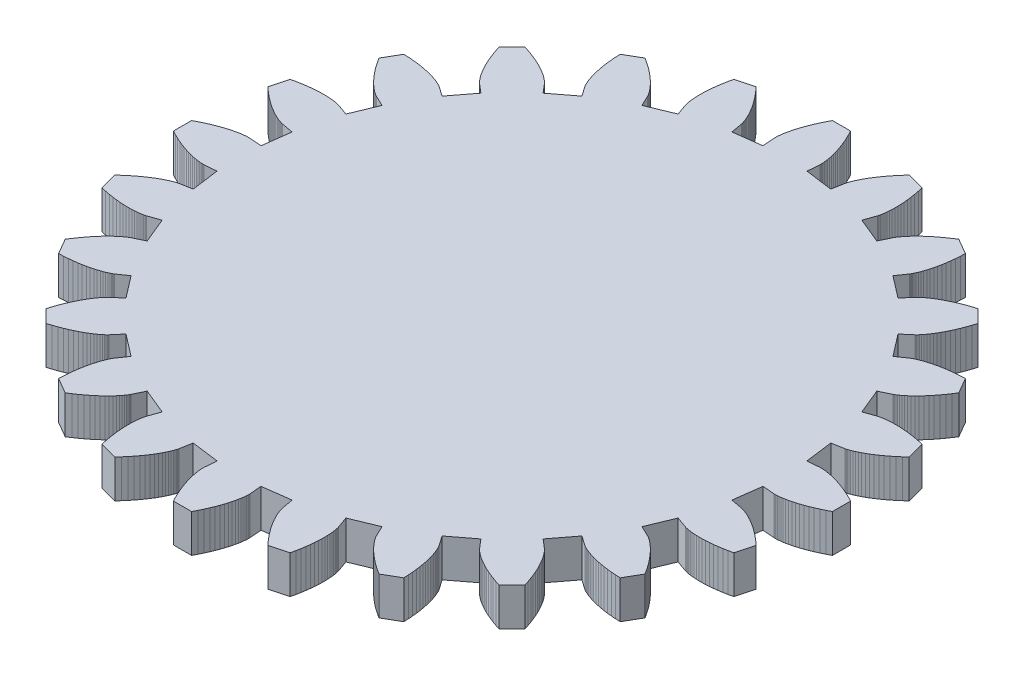
from build123d import *

# Parameters (mm, degrees)
BOSS_EXTRUDE1_DEPTH = 3


with BuildPart() as part:
    # Sketch1 → Boss-Extrude1 (new body)
    with BuildSketch(Plane(origin=(0, 0, 0), x_dir=(1, 0, 0), z_dir=(0, 1, 0))):
        Polygon((21.530304115, 1.73378335), (22.479853223, 1.810248244), (22.490113679, 1.810866937), (22.520933425, 1.81189633), (22.572327881, 1.812095046), (22.644256248, 1.810221715), (22.73662154, 1.80503724), (22.849270696, 1.795307058), (22.981994789, 1.779803389), (23.134529308, 1.75730749), (23.306554532, 1.726611885), (23.497695986, 1.686522588), (23.707524981, 1.6358613), (23.935559237, 1.573467598), (24.181263587, 1.498201084), (24.444050762, 1.408943525), (24.723282261, 1.304600946), (25.018269294, 1.184105704), (25.328273805, 1.046418516), (25.652509577, 0.890530461), (25.9901434, 0.715464925), (25.9901434, -0.715464925), (25.652509577, -0.890530461), (25.328273805, -1.046418516), (25.018269294, -1.184105704), (24.723282261, -1.304600946), (24.444050762, -1.408943525), (24.181263587, -1.498201084), (23.935559237, -1.573467598), (23.707524981, -1.6358613), (23.497695986, -1.686522588), (23.306554532, -1.726611885), (23.134529308, -1.75730749), (22.981994789, -1.779803389), (22.849270696, -1.795307058), (22.73662154, -1.80503724), (22.644256248, -1.810221715), (22.572327881, -1.812095046), (22.520933425, -1.81189633), (22.490113679, -1.810866937), (22.479853223, -1.810248244), (21.530304115, -1.73378335), (21.245412944, -3.897746637), (22.182397521, -4.069648614), (22.19246849, -4.071706604), (22.222504505, -4.078689024), (22.272199169, -4.091798944), (22.341191783, -4.112224874), (22.429067963, -4.141138588), (22.535360336, -4.17969297), (22.65954932, -4.229019887), (22.801063984, -4.290228095), (22.959282983, -4.364401176), (23.133535576, -4.452595513), (23.323102716, -4.555838299), (23.527218215, -4.675125596), (23.745069985, -4.81142043), (23.975801348, -4.965650938), (24.218512418, -5.138708559), (24.472261547, -5.331446288), (24.736066845, -5.54467697), (25.008907753, -5.779171662), (25.289726687, -6.035658048), (24.91937479, -7.417830146), (24.547935266, -7.499544404), (24.194400763, -7.56620231), (23.859323332, -7.618962849), (23.543201275, -7.659004054), (23.246478512, -7.687520816), (22.969544036, -7.705722671), (22.712731453, -7.714831575), (22.476318597, -7.716079655), (22.260527245, -7.710706961), (22.065522904, -7.6999592), (21.891414691, -7.685085474), (21.738255293, -7.667336005), (21.606041019, -7.647959876), (21.494711933, -7.628202764), (21.404152072, -7.609304685), (21.33418975, -7.592497752), (21.284597949, -7.579003944), (21.255094788, -7.570032889), (21.245344077, -7.566779676), (20.347940642, -7.247158867), (19.51268199, -9.263651632), (20.373248086, -9.672205644), (20.382443249, -9.676800069), (20.409648628, -9.691318462), (20.45425689, -9.716843597), (20.515612018, -9.754430133), (20.59301047, -9.805102665), (20.68570241, -9.869853829), (20.792893011, -9.949642446), (20.91374383, -10.045391725), (21.047374242, -10.157987511), (21.192862948, -10.288276588), (21.349249544, -10.437065047), (21.515536152, -10.605116707), (21.690689104, -10.793151594), (21.873640694, -11.001844495), (22.063290976, -11.231823569), (22.258509619, -11.483669027), (22.458137808, -11.757911885), (22.660990195, -12.055032786), (22.865856895, -12.375460899), (22.150391969, -13.614682501), (21.770459734, -13.59747679), (21.411719291, -13.570361921), (21.074403915, -13.534600267), (20.75869003, -13.491458692), (20.464697168, -13.442206266), (20.192488019, -13.388111992), (19.942068554, -13.33044253), (19.713388244, -13.270459933), (19.50634036, -13.209419398), (19.320762356, -13.148567021), (19.15643634, -13.089137582), (19.013089623, -13.032352343), (18.890395352, -12.979416868), (18.787973229, -12.931518875), (18.705390303, -12.889826116), (18.642161844, -12.855484284), (18.597752298, -12.829614963), (18.571576312, -12.81331361), (18.562999842, -12.807647578), (17.77889864, -12.266652483), (16.450194005, -13.998254077), (17.175695463, -14.615617844), (17.183388183, -14.622435601), (17.205908925, -14.643500562), (17.242390806, -14.679701417), (17.291927198, -14.731887098), (17.353573345, -14.800865199), (17.426348049, -14.88740046), (17.509235406, -14.992213315), (17.601186596, -15.11597851), (17.701121728, -15.259323783), (17.807931732, -15.422828615), (17.920480298, -15.607023061), (18.037605856, -15.81238664), (18.158123606, -16.039347313), (18.280827574, -16.288280532), (18.404492716, -16.559508364), (18.527877044, -16.853298698), (18.649723792, -17.169864535), (18.768763604, -17.509363348), (18.883716742, -17.871896541), (17.871896541, -18.883716742), (17.509363348, -18.768763604), (17.169864535, -18.649723792), (16.853298698, -18.527877044), (16.559508364, -18.404492716), (16.288280532, -18.280827574), (16.039347313, -18.158123606), (15.81238664, -18.037605856), (15.607023061, -17.920480298), (15.422828615, -17.807931732), (15.259323783, -17.701121728), (15.11597851, -17.601186596), (14.992213315, -17.509235406), (14.88740046, -17.426348049), (14.800865199, -17.353573345), (14.731887098, -17.291927198), (14.679701417, -17.242390806), (14.643500562, -17.205908925), (14.622435601, -17.183388183), (14.615617844, -17.175695463), (13.998254077, -16.450194005), (12.266652483, -17.77889864), (12.807647578, -18.562999842), (12.81331361, -18.571576312), (12.829614963, -18.597752298), (12.855484284, -18.642161844), (12.889826116, -18.705390303), (12.931518875, -18.787973229), (12.979416868, -18.890395352), (13.032352343, -19.013089623), (13.089137582, -19.15643634), (13.148567021, -19.320762356), (13.209419398, -19.50634036), (13.270459933, -19.713388244), (13.33044253, -19.942068554), (13.388111992, -20.192488019), (13.442206266, -20.464697168), (13.491458692, -20.75869003), (13.534600267, -21.074403915), (13.570361921, -21.411719291), (13.59747679, -21.770459734), (13.614682501, -22.150391969), (12.375460899, -22.865856895), (12.055032786, -22.660990195), (11.757911885, -22.458137808), (11.483669027, -22.258509619), (11.231823569, -22.063290976), (11.001844495, -21.873640694), (10.793151594, -21.690689104), (10.605116707, -21.515536152), (10.437065047, -21.349249544), (10.288276588, -21.192862948), (10.157987511, -21.047374242), (10.045391725, -20.91374383), (9.949642446, -20.792893011), (9.869853829, -20.68570241), (9.805102665, -20.59301047), (9.754430133, -20.515612018), (9.716843597, -20.45425689), (9.691318462, -20.409648628), (9.676800069, -20.382443249), (9.672205644, -20.373248086), (9.263651632, -19.51268199), (7.247158867, -20.347940642), (7.566779676, -21.245344077), (7.570032889, -21.255094788), (7.579003944, -21.284597949), (7.592497752, -21.33418975), (7.609304685, -21.404152072), (7.628202764, -21.494711933), (7.647959876, -21.606041019), (7.667336005, -21.738255293), (7.685085474, -21.891414691), (7.6999592, -22.065522904), (7.710706961, -22.260527245), (7.716079655, -22.476318597), (7.714831575, -22.712731453), (7.705722671, -22.969544036), (7.687520816, -23.246478512), (7.659004054, -23.543201275), (7.618962849, -23.859323332), (7.56620231, -24.194400763), (7.499544404, -24.547935266), (7.417830146, -24.91937479), (6.035658048, -25.289726687), (5.779171662, -25.008907753), (5.54467697, -24.736066845), (5.331446288, -24.472261547), (5.138708559, -24.218512418), (4.965650938, -23.975801348), (4.81142043, -23.745069985), (4.675125596, -23.527218215), (4.555838299, -23.323102716), (4.452595513, -23.133535576), (4.364401176, -22.959282983), (4.290228095, -22.801063984), (4.229019887, -22.65954932), (4.17969297, -22.535360336), (4.141138588, -22.429067963), (4.112224874, -22.341191783), (4.091798944, -22.272199169), (4.078689024, -22.222504505), (4.071706604, -22.19246849), (4.069648614, -22.182397521), (3.897746637, -21.245412944), (1.73378335, -21.530304115), (1.810248244, -22.479853223), (1.810866937, -22.490113679), (1.81189633, -22.520933425), (1.812095046, -22.572327881), (1.810221715, -22.644256248), (1.80503724, -22.73662154), (1.795307058, -22.849270696), (1.779803389, -22.981994789), (1.75730749, -23.134529308), (1.726611885, -23.306554532), (1.686522588, -23.497695986), (1.6358613, -23.707524981), (1.573467598, -23.935559237), (1.498201084, -24.181263587), (1.408943525, -24.444050762), (1.304600946, -24.723282261), (1.184105704, -25.018269294), (1.046418516, -25.328273805), (0.890530461, -25.652509577), (0.715464925, -25.9901434), (-0.715464925, -25.9901434), (-0.890530461, -25.652509577), (-1.046418516, -25.328273805), (-1.184105704, -25.018269294), (-1.304600946, -24.723282261), (-1.408943525, -24.444050762), (-1.498201084, -24.181263587), (-1.573467598, -23.935559237), (-1.6358613, -23.707524981), (-1.686522588, -23.497695986), (-1.726611885, -23.306554532), (-1.75730749, -23.134529308), (-1.779803389, -22.981994789), (-1.795307058, -22.849270696), (-1.80503724, -22.73662154), (-1.810221715, -22.644256248), (-1.812095046, -22.572327881), (-1.81189633, -22.520933425), (-1.810866937, -22.490113679), (-1.810248244, -22.479853223), (-1.73378335, -21.530304115), (-3.897746637, -21.245412944), (-4.069648614, -22.182397521), (-4.071706604, -22.19246849), (-4.078689024, -22.222504505), (-4.091798944, -22.272199169), (-4.112224874, -22.341191783), (-4.141138588, -22.429067963), (-4.17969297, -22.535360336), (-4.229019887, -22.65954932), (-4.290228095, -22.801063984), (-4.364401176, -22.959282983), (-4.452595513, -23.133535576), (-4.555838299, -23.323102716), (-4.675125596, -23.527218215), (-4.81142043, -23.745069985), (-4.965650938, -23.975801348), (-5.138708559, -24.218512418), (-5.331446288, -24.472261547), (-5.54467697, -24.736066845), (-5.779171662, -25.008907753), (-6.035658048, -25.289726687), (-7.417830146, -24.91937479), (-7.499544404, -24.547935266), (-7.56620231, -24.194400763), (-7.618962849, -23.859323332), (-7.659004054, -23.543201275), (-7.687520816, -23.246478512), (-7.705722671, -22.969544036), (-7.714831575, -22.712731453), (-7.716079655, -22.476318597), (-7.710706961, -22.260527245), (-7.6999592, -22.065522904), (-7.685085474, -21.891414691), (-7.667336005, -21.738255293), (-7.647959876, -21.606041019), (-7.628202764, -21.494711933), (-7.609304685, -21.404152072), (-7.592497752, -21.33418975), (-7.579003944, -21.284597949), (-7.570032889, -21.255094788), (-7.566779676, -21.245344077), (-7.247158867, -20.347940642), (-9.263651632, -19.51268199), (-9.672205644, -20.373248086), (-9.676800069, -20.382443249), (-9.691318462, -20.409648628), (-9.716843597, -20.45425689), (-9.754430133, -20.515612018), (-9.805102665, -20.59301047), (-9.869853829, -20.68570241), (-9.949642446, -20.792893011), (-10.045391725, -20.91374383), (-10.157987511, -21.047374242), (-10.288276588, -21.192862948), (-10.437065047, -21.349249544), (-10.605116707, -21.515536152), (-10.793151594, -21.690689104), (-11.001844495, -21.873640694), (-11.231823569, -22.063290976), (-11.483669027, -22.258509619), (-11.757911885, -22.458137808), (-12.055032786, -22.660990195), (-12.375460899, -22.865856895), (-13.614682501, -22.150391969), (-13.59747679, -21.770459734), (-13.570361921, -21.411719291), (-13.534600267, -21.074403915), (-13.491458692, -20.75869003), (-13.442206266, -20.464697168), (-13.388111992, -20.192488019), (-13.33044253, -19.942068554), (-13.270459933, -19.713388244), (-13.209419398, -19.50634036), (-13.148567021, -19.320762356), (-13.089137582, -19.15643634), (-13.032352343, -19.013089623), (-12.979416868, -18.890395352), (-12.931518875, -18.787973229), (-12.889826116, -18.705390303), (-12.855484284, -18.642161844), (-12.829614963, -18.597752298), (-12.81331361, -18.571576312), (-12.807647578, -18.562999842), (-12.266652483, -17.77889864), (-13.998254077, -16.450194005), (-14.615617844, -17.175695463), (-14.622435601, -17.183388183), (-14.643500562, -17.205908925), (-14.679701417, -17.242390806), (-14.731887098, -17.291927198), (-14.800865199, -17.353573345), (-14.88740046, -17.426348049), (-14.992213315, -17.509235406), (-15.11597851, -17.601186596), (-15.259323783, -17.701121728), (-15.422828615, -17.807931732), (-15.607023061, -17.920480298), (-15.81238664, -18.037605856), (-16.039347313, -18.158123606), (-16.288280532, -18.280827574), (-16.559508364, -18.404492716), (-16.853298698, -18.527877044), (-17.169864535, -18.649723792), (-17.509363348, -18.768763604), (-17.871896541, -18.883716742), (-18.883716742, -17.871896541), (-18.768763604, -17.509363348), (-18.649723792, -17.169864535), (-18.527877044, -16.853298698), (-18.404492716, -16.559508364), (-18.280827574, -16.288280532), (-18.158123606, -16.039347313), (-18.037605856, -15.81238664), (-17.920480298, -15.607023061), (-17.807931732, -15.422828615), (-17.701121728, -15.259323783), (-17.601186596, -15.11597851), (-17.509235406, -14.992213315), (-17.426348049, -14.88740046), (-17.353573345, -14.800865199), (-17.291927198, -14.731887098), (-17.242390806, -14.679701417), (-17.205908925, -14.643500562), (-17.183388183, -14.622435601), (-17.175695463, -14.615617844), (-16.450194005, -13.998254077), (-17.77889864, -12.266652483), (-18.562999842, -12.807647578), (-18.571576312, -12.81331361), (-18.597752298, -12.829614963), (-18.642161844, -12.855484284), (-18.705390303, -12.889826116), (-18.787973229, -12.931518875), (-18.890395352, -12.979416868), (-19.013089623, -13.032352343), (-19.15643634, -13.089137582), (-19.320762356, -13.148567021), (-19.50634036, -13.209419398), (-19.713388244, -13.270459933), (-19.942068554, -13.33044253), (-20.192488019, -13.388111992), (-20.464697168, -13.442206266), (-20.75869003, -13.491458692), (-21.074403915, -13.534600267), (-21.411719291, -13.570361921), (-21.770459734, -13.59747679), (-22.150391969, -13.614682501), (-22.865856895, -12.375460899), (-22.660990195, -12.055032786), (-22.458137808, -11.757911885), (-22.258509619, -11.483669027), (-22.063290976, -11.231823569), (-21.873640694, -11.001844495), (-21.690689104, -10.793151594), (-21.515536152, -10.605116707), (-21.349249544, -10.437065047), (-21.192862948, -10.288276588), (-21.047374242, -10.157987511), (-20.91374383, -10.045391725), (-20.792893011, -9.949642446), (-20.68570241, -9.869853829), (-20.59301047, -9.805102665), (-20.515612018, -9.754430133), (-20.45425689, -9.716843597), (-20.409648628, -9.691318462), (-20.382443249, -9.676800069), (-20.373248086, -9.672205644), (-19.51268199, -9.263651632), (-20.347940642, -7.247158867), (-21.245344077, -7.566779676), (-21.255094788, -7.570032889), (-21.284597949, -7.579003944), (-21.33418975, -7.592497752), (-21.404152072, -7.609304685), (-21.494711933, -7.628202764), (-21.606041019, -7.647959876), (-21.738255293, -7.667336005), (-21.891414691, -7.685085474), (-22.065522904, -7.6999592), (-22.260527245, -7.710706961), (-22.476318597, -7.716079655), (-22.712731453, -7.714831575), (-22.969544036, -7.705722671), (-23.246478512, -7.687520816), (-23.543201275, -7.659004054), (-23.859323332, -7.618962849), (-24.194400763, -7.56620231), (-24.547935266, -7.499544404), (-24.91937479, -7.417830146), (-25.289726687, -6.035658048), (-25.008907753, -5.779171662), (-24.736066845, -5.54467697), (-24.472261547, -5.331446288), (-24.218512418, -5.138708559), (-23.975801348, -4.965650938), (-23.745069985, -4.81142043), (-23.527218215, -4.675125596), (-23.323102716, -4.555838299), (-23.133535576, -4.452595513), (-22.959282983, -4.364401176), (-22.801063984, -4.290228095), (-22.65954932, -4.229019887), (-22.535360336, -4.17969297), (-22.429067963, -4.141138588), (-22.341191783, -4.112224874), (-22.272199169, -4.091798944), (-22.222504505, -4.078689024), (-22.19246849, -4.071706604), (-22.182397521, -4.069648614), (-21.245412944, -3.897746637), (-21.530304115, -1.73378335), (-22.479853223, -1.810248244), (-22.490113679, -1.810866937), (-22.520933425, -1.81189633), (-22.572327881, -1.812095046), (-22.644256248, -1.810221715), (-22.73662154, -1.80503724), (-22.849270696, -1.795307058), (-22.981994789, -1.779803389), (-23.134529308, -1.75730749), (-23.306554532, -1.726611885), (-23.497695986, -1.686522588), (-23.707524981, -1.6358613), (-23.935559237, -1.573467598), (-24.181263587, -1.498201084), (-24.444050762, -1.408943525), (-24.723282261, -1.304600946), (-25.018269294, -1.184105704), (-25.328273805, -1.046418516), (-25.652509577, -0.890530461), (-25.9901434, -0.715464925), (-25.9901434, 0.715464925), (-25.652509577, 0.890530461), (-25.328273805, 1.046418516), (-25.018269294, 1.184105704), (-24.723282261, 1.304600946), (-24.444050762, 1.408943525), (-24.181263587, 1.498201084), (-23.935559237, 1.573467598), (-23.707524981, 1.6358613), (-23.497695986, 1.686522588), (-23.306554532, 1.726611885), (-23.134529308, 1.75730749), (-22.981994789, 1.779803389), (-22.849270696, 1.795307058), (-22.73662154, 1.80503724), (-22.644256248, 1.810221715), (-22.572327881, 1.812095046), (-22.520933425, 1.81189633), (-22.490113679, 1.810866937), (-22.479853223, 1.810248244), (-21.530304115, 1.73378335), (-21.245412944, 3.897746637), (-22.182397521, 4.069648614), (-22.19246849, 4.071706604), (-22.222504505, 4.078689024), (-22.272199169, 4.091798944), (-22.341191783, 4.112224874), (-22.429067963, 4.141138588), (-22.535360336, 4.17969297), (-22.65954932, 4.229019887), (-22.801063984, 4.290228095), (-22.959282983, 4.364401176), (-23.133535576, 4.452595513), (-23.323102716, 4.555838299), (-23.527218215, 4.675125596), (-23.745069985, 4.81142043), (-23.975801348, 4.965650938), (-24.218512418, 5.138708559), (-24.472261547, 5.331446288), (-24.736066845, 5.54467697), (-25.008907753, 5.779171662), (-25.289726687, 6.035658048), (-24.91937479, 7.417830146), (-24.547935266, 7.499544404), (-24.194400763, 7.56620231), (-23.859323332, 7.618962849), (-23.543201275, 7.659004054), (-23.246478512, 7.687520816), (-22.969544036, 7.705722671), (-22.712731453, 7.714831575), (-22.476318597, 7.716079655), (-22.260527245, 7.710706961), (-22.065522904, 7.6999592), (-21.891414691, 7.685085474), (-21.738255293, 7.667336005), (-21.606041019, 7.647959876), (-21.494711933, 7.628202764), (-21.404152072, 7.609304685), (-21.33418975, 7.592497752), (-21.284597949, 7.579003944), (-21.255094788, 7.570032889), (-21.245344077, 7.566779676), (-20.347940642, 7.247158867), (-19.51268199, 9.263651632), (-20.373248086, 9.672205644), (-20.382443249, 9.676800069), (-20.409648628, 9.691318462), (-20.45425689, 9.716843597), (-20.515612018, 9.754430133), (-20.59301047, 9.805102665), (-20.68570241, 9.869853829), (-20.792893011, 9.949642446), (-20.91374383, 10.045391725), (-21.047374242, 10.157987511), (-21.192862948, 10.288276588), (-21.349249544, 10.437065047), (-21.515536152, 10.605116707), (-21.690689104, 10.793151594), (-21.873640694, 11.001844495), (-22.063290976, 11.231823569), (-22.258509619, 11.483669027), (-22.458137808, 11.757911885), (-22.660990195, 12.055032786), (-22.865856895, 12.375460899), (-22.150391969, 13.614682501), (-21.770459734, 13.59747679), (-21.411719291, 13.570361921), (-21.074403915, 13.534600267), (-20.75869003, 13.491458692), (-20.464697168, 13.442206266), (-20.192488019, 13.388111992), (-19.942068554, 13.33044253), (-19.713388244, 13.270459933), (-19.50634036, 13.209419398), (-19.320762356, 13.148567021), (-19.15643634, 13.089137582), (-19.013089623, 13.032352343), (-18.890395352, 12.979416868), (-18.787973229, 12.931518875), (-18.705390303, 12.889826116), (-18.642161844, 12.855484284), (-18.597752298, 12.829614963), (-18.571576312, 12.81331361), (-18.562999842, 12.807647578), (-17.77889864, 12.266652483), (-16.450194005, 13.998254077), (-17.175695463, 14.615617844), (-17.183388183, 14.622435601), (-17.205908925, 14.643500562), (-17.242390806, 14.679701417), (-17.291927198, 14.731887098), (-17.353573345, 14.800865199), (-17.426348049, 14.88740046), (-17.509235406, 14.992213315), (-17.601186596, 15.11597851), (-17.701121728, 15.259323783), (-17.807931732, 15.422828615), (-17.920480298, 15.607023061), (-18.037605856, 15.81238664), (-18.158123606, 16.039347313), (-18.280827574, 16.288280532), (-18.404492716, 16.559508364), (-18.527877044, 16.853298698), (-18.649723792, 17.169864535), (-18.768763604, 17.509363348), (-18.883716742, 17.871896541), (-17.871896541, 18.883716742), (-17.509363348, 18.768763604), (-17.169864535, 18.649723792), (-16.853298698, 18.527877044), (-16.559508364, 18.404492716), (-16.288280532, 18.280827574), (-16.039347313, 18.158123606), (-15.81238664, 18.037605856), (-15.607023061, 17.920480298), (-15.422828615, 17.807931732), (-15.259323783, 17.701121728), (-15.11597851, 17.601186596), (-14.992213315, 17.509235406), (-14.88740046, 17.426348049), (-14.800865199, 17.353573345), (-14.731887098, 17.291927198), (-14.679701417, 17.242390806), (-14.643500562, 17.205908925), (-14.622435601, 17.183388183), (-14.615617844, 17.175695463), (-13.998254077, 16.450194005), (-12.266652483, 17.77889864), (-12.807647578, 18.562999842), (-12.81331361, 18.571576312), (-12.829614963, 18.597752298), (-12.855484284, 18.642161844), (-12.889826116, 18.705390303), (-12.931518875, 18.787973229), (-12.979416868, 18.890395352), (-13.032352343, 19.013089623), (-13.089137582, 19.15643634), (-13.148567021, 19.320762356), (-13.209419398, 19.50634036), (-13.270459933, 19.713388244), (-13.33044253, 19.942068554), (-13.388111992, 20.192488019), (-13.442206266, 20.464697168), (-13.491458692, 20.75869003), (-13.534600267, 21.074403915), (-13.570361921, 21.411719291), (-13.59747679, 21.770459734), (-13.614682501, 22.150391969), (-12.375460899, 22.865856895), (-12.055032786, 22.660990195), (-11.757911885, 22.458137808), (-11.483669027, 22.258509619), (-11.231823569, 22.063290976), (-11.001844495, 21.873640694), (-10.793151594, 21.690689104), (-10.605116707, 21.515536152), (-10.437065047, 21.349249544), (-10.288276588, 21.192862948), (-10.157987511, 21.047374242), (-10.045391725, 20.91374383), (-9.949642446, 20.792893011), (-9.869853829, 20.68570241), (-9.805102665, 20.59301047), (-9.754430133, 20.515612018), (-9.716843597, 20.45425689), (-9.691318462, 20.409648628), (-9.676800069, 20.382443249), (-9.672205644, 20.373248086), (-9.263651632, 19.51268199), (-7.247158867, 20.347940642), (-7.566779676, 21.245344077), (-7.570032889, 21.255094788), (-7.579003944, 21.284597949), (-7.592497752, 21.33418975), (-7.609304685, 21.404152072), (-7.628202764, 21.494711933), (-7.647959876, 21.606041019), (-7.667336005, 21.738255293), (-7.685085474, 21.891414691), (-7.6999592, 22.065522904), (-7.710706961, 22.260527245), (-7.716079655, 22.476318597), (-7.714831575, 22.712731453), (-7.705722671, 22.969544036), (-7.687520816, 23.246478512), (-7.659004054, 23.543201275), (-7.618962849, 23.859323332), (-7.56620231, 24.194400763), (-7.499544404, 24.547935266), (-7.417830146, 24.91937479), (-6.035658048, 25.289726687), (-5.779171662, 25.008907753), (-5.54467697, 24.736066845), (-5.331446288, 24.472261547), (-5.138708559, 24.218512418), (-4.965650938, 23.975801348), (-4.81142043, 23.745069985), (-4.675125596, 23.527218215), (-4.555838299, 23.323102716), (-4.452595513, 23.133535576), (-4.364401176, 22.959282983), (-4.290228095, 22.801063984), (-4.229019887, 22.65954932), (-4.17969297, 22.535360336), (-4.141138588, 22.429067963), (-4.112224874, 22.341191783), (-4.091798944, 22.272199169), (-4.078689024, 22.222504505), (-4.071706604, 22.19246849), (-4.069648614, 22.182397521), (-3.897746637, 21.245412944), (-1.73378335, 21.530304115), (-1.810248244, 22.479853223), (-1.810866937, 22.490113679), (-1.81189633, 22.520933425), (-1.812095046, 22.572327881), (-1.810221715, 22.644256248), (-1.80503724, 22.73662154), (-1.795307058, 22.849270696), (-1.779803389, 22.981994789), (-1.75730749, 23.134529308), (-1.726611885, 23.306554532), (-1.686522588, 23.497695986), (-1.6358613, 23.707524981), (-1.573467598, 23.935559237), (-1.498201084, 24.181263587), (-1.408943525, 24.444050762), (-1.304600946, 24.723282261), (-1.184105704, 25.018269294), (-1.046418516, 25.328273805), (-0.890530461, 25.652509577), (-0.715464925, 25.9901434), (0.715464925, 25.9901434), (0.890530461, 25.652509577), (1.046418516, 25.328273805), (1.184105704, 25.018269294), (1.304600946, 24.723282261), (1.408943525, 24.444050762), (1.498201084, 24.181263587), (1.573467598, 23.935559237), (1.6358613, 23.707524981), (1.686522588, 23.497695986), (1.726611885, 23.306554532), (1.75730749, 23.134529308), (1.779803389, 22.981994789), (1.795307058, 22.849270696), (1.80503724, 22.73662154), (1.810221715, 22.644256248), (1.812095046, 22.572327881), (1.81189633, 22.520933425), (1.810866937, 22.490113679), (1.810248244, 22.479853223), (1.73378335, 21.530304115), (3.897746637, 21.245412944), (4.069648614, 22.182397521), (4.071706604, 22.19246849), (4.078689024, 22.222504505), (4.091798944, 22.272199169), (4.112224874, 22.341191783), (4.141138588, 22.429067963), (4.17969297, 22.535360336), (4.229019887, 22.65954932), (4.290228095, 22.801063984), (4.364401176, 22.959282983), (4.452595513, 23.133535576), (4.555838299, 23.323102716), (4.675125596, 23.527218215), (4.81142043, 23.745069985), (4.965650938, 23.975801348), (5.138708559, 24.218512418), (5.331446288, 24.472261547), (5.54467697, 24.736066845), (5.779171662, 25.008907753), (6.035658048, 25.289726687), (7.417830146, 24.91937479), (7.499544404, 24.547935266), (7.56620231, 24.194400763), (7.618962849, 23.859323332), (7.659004054, 23.543201275), (7.687520816, 23.246478512), (7.705722671, 22.969544036), (7.714831575, 22.712731453), (7.716079655, 22.476318597), (7.710706961, 22.260527245), (7.6999592, 22.065522904), (7.685085474, 21.891414691), (7.667336005, 21.738255293), (7.647959876, 21.606041019), (7.628202764, 21.494711933), (7.609304685, 21.404152072), (7.592497752, 21.33418975), (7.579003944, 21.284597949), (7.570032889, 21.255094788), (7.566779676, 21.245344077), (7.247158867, 20.347940642), (9.263651632, 19.51268199), (9.672205644, 20.373248086), (9.676800069, 20.382443249), (9.691318462, 20.409648628), (9.716843597, 20.45425689), (9.754430133, 20.515612018), (9.805102665, 20.59301047), (9.869853829, 20.68570241), (9.949642446, 20.792893011), (10.045391725, 20.91374383), (10.157987511, 21.047374242), (10.288276588, 21.192862948), (10.437065047, 21.349249544), (10.605116707, 21.515536152), (10.793151594, 21.690689104), (11.001844495, 21.873640694), (11.231823569, 22.063290976), (11.483669027, 22.258509619), (11.757911885, 22.458137808), (12.055032786, 22.660990195), (12.375460899, 22.865856895), (13.614682501, 22.150391969), (13.59747679, 21.770459734), (13.570361921, 21.411719291), (13.534600267, 21.074403915), (13.491458692, 20.75869003), (13.442206266, 20.464697168), (13.388111992, 20.192488019), (13.33044253, 19.942068554), (13.270459933, 19.713388244), (13.209419398, 19.50634036), (13.148567021, 19.320762356), (13.089137582, 19.15643634), (13.032352343, 19.013089623), (12.979416868, 18.890395352), (12.931518875, 18.787973229), (12.889826116, 18.705390303), (12.855484284, 18.642161844), (12.829614963, 18.597752298), (12.81331361, 18.571576312), (12.807647578, 18.562999842), (12.266652483, 17.77889864), (13.998254077, 16.450194005), (14.615617844, 17.175695463), (14.622435601, 17.183388183), (14.643500562, 17.205908925), (14.679701417, 17.242390806), (14.731887098, 17.291927198), (14.800865199, 17.353573345), (14.88740046, 17.426348049), (14.992213315, 17.509235406), (15.11597851, 17.601186596), (15.259323783, 17.701121728), (15.422828615, 17.807931732), (15.607023061, 17.920480298), (15.81238664, 18.037605856), (16.039347313, 18.158123606), (16.288280532, 18.280827574), (16.559508364, 18.404492716), (16.853298698, 18.527877044), (17.169864535, 18.649723792), (17.509363348, 18.768763604), (17.871896541, 18.883716742), (18.883716742, 17.871896541), (18.768763604, 17.509363348), (18.649723792, 17.169864535), (18.527877044, 16.853298698), (18.404492716, 16.559508364), (18.280827574, 16.288280532), (18.158123606, 16.039347313), (18.037605856, 15.81238664), (17.920480298, 15.607023061), (17.807931732, 15.422828615), (17.701121728, 15.259323783), (17.601186596, 15.11597851), (17.509235406, 14.992213315), (17.426348049, 14.88740046), (17.353573345, 14.800865199), (17.291927198, 14.731887098), (17.242390806, 14.679701417), (17.205908925, 14.643500562), (17.183388183, 14.622435601), (17.175695463, 14.615617844), (16.450194005, 13.998254077), (17.77889864, 12.266652483), (18.562999842, 12.807647578), (18.571576312, 12.81331361), (18.597752298, 12.829614963), (18.642161844, 12.855484284), (18.705390303, 12.889826116), (18.787973229, 12.931518875), (18.890395352, 12.979416868), (19.013089623, 13.032352343), (19.15643634, 13.089137582), (19.320762356, 13.148567021), (19.50634036, 13.209419398), (19.713388244, 13.270459933), (19.942068554, 13.33044253), (20.192488019, 13.388111992), (20.464697168, 13.442206266), (20.75869003, 13.491458692), (21.074403915, 13.534600267), (21.411719291, 13.570361921), (21.770459734, 13.59747679), (22.150391969, 13.614682501), (22.865856895, 12.375460899), (22.660990195, 12.055032786), (22.458137808, 11.757911885), (22.258509619, 11.483669027), (22.063290976, 11.231823569), (21.873640694, 11.001844495), (21.690689104, 10.793151594), (21.515536152, 10.605116707), (21.349249544, 10.437065047), (21.192862948, 10.288276588), (21.047374242, 10.157987511), (20.91374383, 10.045391725), (20.792893011, 9.949642446), (20.68570241, 9.869853829), (20.59301047, 9.805102665), (20.515612018, 9.754430133), (20.45425689, 9.716843597), (20.409648628, 9.691318462), (20.382443249, 9.676800069), (20.373248086, 9.672205644), (19.51268199, 9.263651632), (20.347940642, 7.247158867), (21.245344077, 7.566779676), (21.255094788, 7.570032889), (21.284597949, 7.579003944), (21.33418975, 7.592497752), (21.404152072, 7.609304685), (21.494711933, 7.628202764), (21.606041019, 7.647959876), (21.738255293, 7.667336005), (21.891414691, 7.685085474), (22.065522904, 7.6999592), (22.260527245, 7.710706961), (22.476318597, 7.716079655), (22.712731453, 7.714831575), (22.969544036, 7.705722671), (23.246478512, 7.687520816), (23.543201275, 7.659004054), (23.859323332, 7.618962849), (24.194400763, 7.56620231), (24.547935266, 7.499544404), (24.91937479, 7.417830146), (25.289726687, 6.035658048), (25.008907753, 5.779171662), (24.736066845, 5.54467697), (24.472261547, 5.331446288), (24.218512418, 5.138708559), (23.975801348, 4.965650938), (23.745069985, 4.81142043), (23.527218215, 4.675125596), (23.323102716, 4.555838299), (23.133535576, 4.452595513), (22.959282983, 4.364401176), (22.801063984, 4.290228095), (22.65954932, 4.229019887), (22.535360336, 4.17969297), (22.429067963, 4.141138588), (22.341191783, 4.112224874), (22.272199169, 4.091798944), (22.222504505, 4.078689024), (22.19246849, 4.071706604), (22.182397521, 4.069648614), (21.245412944, 3.897746637), align=None)
    extrude(amount=BOSS_EXTRUDE1_DEPTH)


solid = part.part
